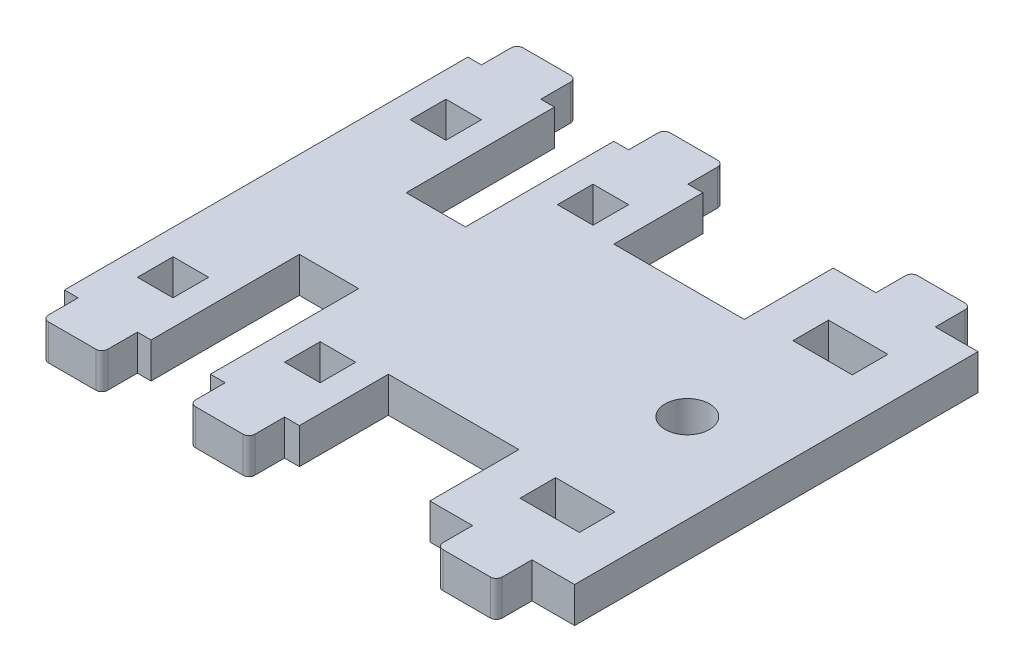
from build123d import *

# Parameters (mm, degrees)
SKETCH1_W                  = 86
SKETCH1_H                  = 68
BOSS_EXTRUDE1_DEPTH        = 6
SKETCH2_W                  = 10
SKETCH2_H                  = 25
SKETCH2_W_2                = 22
SKETCH2_H_2                = 15
CUT_EXTRUDE1_DEPTH         = 110.79981785
F_7_5_7_5_DIAMETER_HOLE1_D = 7.5
SKETCH234_W                = 10
SKETCH234_H                = 6
BOSS_EXTRUDE234_DEPTH      = 6
FILLET134_R                = 1
SKETCH2341_W               = 10
SKETCH2341_H               = 6
BOSS_EXTRUDE2341_DEPTH     = 6
FILLET1341_R               = 1
SKETCH2342_W               = 10
SKETCH2342_H               = 6
BOSS_EXTRUDE2342_DEPTH     = 6
FILLET1342_R               = 1
CUT_EXTRUDE11_START        = -3
SKETCH6_W                  = 10
SKETCH6_H                  = 6
CUT_EXTRUDE11_DEPTH        = 6
CUT_EXTRUDE16_DEPTH        = 82.966859266
CUT_EXTRUDE16_DEPTH_BACK   = 82.966859266
SKETCH64_W                 = 6
SKETCH64_H                 = 6
CUT_EXTRUDE18_DEPTH        = 101.225385192
CUT_EXTRUDE18_DEPTH_BACK   = 101.225385192
SKETCH66_W                 = 6
SKETCH66_H                 = 6
MIRROR2_OUTLINE_W          = 10
MIRROR2_OUTLINE_H          = 6
MIRROR2_OUTLINE_W_2        = 6
MIRROR2_DEPTH              = 6
MIRROR2_2_DEPTH            = 6


# Read off the part's stored shape, not the designer's step: Mirror2
with BuildPart() as part:
    # Sketch1 → Boss-Extrude1 (new body)
    with BuildSketch(Plane(origin=(0, 0, 0), x_dir=(1, 0, 0), z_dir=(0, 1, 0))):
        with Locations((43, -34)):
            Rectangle(SKETCH1_W, SKETCH1_H)
    extrude(amount=BOSS_EXTRUDE1_DEPTH)

    # Sketch2 → Cut-Extrude1 (cut, through all)
    with BuildSketch(Plane(origin=(0, 6, 0), x_dir=(1, 0, 0), z_dir=(0, 1, 0))):
        with Locations((19.6, -55.5)):
            Rectangle(SKETCH2_W, SKETCH2_H)
        with Locations((50.6, -60.5)):
            Rectangle(SKETCH2_W_2, SKETCH2_H_2)
    cut_extrude1 = extrude(amount=-CUT_EXTRUDE1_DEPTH, mode=Mode.SUBTRACT)

    # Mirror1: Cut-Extrude1 across plane
    add(cut_extrude1.mirror(Plane.XY.offset(34)), mode=Mode.SUBTRACT)

    # Ø7.5 (7.5) Diameter Hole1 (through all)
    with Locations(Plane(origin=(0, 0, 0), x_dir=(-1, 0, 0), z_dir=(0, -1, 0))):
        with Locations((-71, -34)):
            Hole(F_7_5_7_5_DIAMETER_HOLE1_D / 2)

    # Sketch234 → Boss-Extrude234 (add)
    with BuildSketch(Plane(origin=(73.032221392, 0, 68), x_dir=(1, 0, 0), z_dir=(0, 0, 1))):
        with Locations((0.767778608, 3)):
            Rectangle(SKETCH234_W, SKETCH234_H)
    extrude(amount=BOSS_EXTRUDE234_DEPTH)

    # Fillet134
    fillet134_edges = [part.edges().sort_by_distance(p)[0] for p in [
        (78.8, 3, 74),
        (68.8, 3, 74),
    ]]
    fillet(fillet134_edges, radius=FILLET134_R)

    # Sketch2341 → Boss-Extrude2341 (add)
    with BuildSketch(Plane(origin=(31.332221392, 0, 68), x_dir=(1, 0, 0), z_dir=(0, 0, 1))):
        with Locations((0.767778608, 3)):
            Rectangle(SKETCH2341_W, SKETCH2341_H)
    extrude(amount=BOSS_EXTRUDE2341_DEPTH)

    # Fillet1341
    fillet1341_edges = [part.edges().sort_by_distance(p)[0] for p in [
        (37.1, 3, 74),
        (27.1, 3, 74),
    ]]
    fillet(fillet1341_edges, radius=FILLET1341_R)

    # Sketch2342 → Boss-Extrude2342 (add)
    with BuildSketch(Plane(origin=(6.532221392, 0, 68), x_dir=(1, 0, 0), z_dir=(0, 0, 1))):
        with Locations((0.767778608, 3)):
            Rectangle(SKETCH2342_W, SKETCH2342_H)
    extrude(amount=BOSS_EXTRUDE2342_DEPTH)

    # Fillet1342
    fillet1342_edges = [part.edges().sort_by_distance(p)[0] for p in [
        (12.3, 3, 74),
        (2.3, 3, 74),
    ]]
    fillet(fillet1342_edges, radius=FILLET1342_R)

    # Sketch6 → Cut-Extrude11 (cut)
    with BuildSketch(Plane(origin=(73.032221392, 3, 13), x_dir=(1, 0, 0), z_dir=(0, 1, 0)).offset(CUT_EXTRUDE11_START)):
        with Locations((0.767778608, -44)):
            Rectangle(SKETCH6_W, SKETCH6_H)
    extrude(amount=CUT_EXTRUDE11_DEPTH, mode=Mode.SUBTRACT)

    # Sketch64 → Cut-Extrude16 (cut, two sides: drawn at the far end of the back side and taken through both)
    with BuildSketch(Plane(origin=(31.332221392, 3, 13), x_dir=(1, 0, 0), z_dir=(0, 1, 0)).offset(-CUT_EXTRUDE16_DEPTH_BACK)):
        with Locations((0.767778608, -44)):
            Rectangle(SKETCH64_W, SKETCH64_H)
    extrude(amount=CUT_EXTRUDE16_DEPTH + CUT_EXTRUDE16_DEPTH_BACK, mode=Mode.SUBTRACT)

    # Sketch66 → Cut-Extrude18 (cut, two sides: drawn at the far end of the back side and taken through both)
    with BuildSketch(Plane(origin=(6.532221392, 3, 13), x_dir=(1, 0, 0), z_dir=(0, 1, 0)).offset(-CUT_EXTRUDE18_DEPTH_BACK)):
        with Locations((0.767778608, -44)):
            Rectangle(SKETCH66_W, SKETCH66_H)
    extrude(amount=CUT_EXTRUDE18_DEPTH + CUT_EXTRUDE18_DEPTH_BACK, mode=Mode.SUBTRACT)

    # Mirror2 outline → Mirror2 (cut)
    with BuildSketch(Plane(origin=(0, 0, 0), x_dir=(1, 0, 0), z_dir=(0, 1, 0))):
        with Locations((73.8, -11)):
            Rectangle(MIRROR2_OUTLINE_W, MIRROR2_OUTLINE_H)
        with Locations((32.1, -11)):
            Rectangle(MIRROR2_OUTLINE_W_2, MIRROR2_OUTLINE_H)
        with Locations((7.3, -11)):
            Rectangle(MIRROR2_OUTLINE_W_2, MIRROR2_OUTLINE_H)
    extrude(amount=MIRROR2_DEPTH, mode=Mode.SUBTRACT)

    # Mirror2 2 outline → Mirror2 2 (add)
    with BuildSketch(Plane(origin=(0, 0, 0), x_dir=(1, 0, 0), z_dir=(0, 1, 0))):
        with BuildLine():
            Line((68.8, 0), (78.8, 0))
            Line((78.8, 0), (78.8, 5))
            ThreePointArc((78.8, 5), (78.507106781, 5.707106781), (77.8, 6))
            Line((77.8, 6), (69.8, 6))
            ThreePointArc((69.8, 6), (69.092893219, 5.707106781), (68.8, 5))
            Line((68.8, 5), (68.8, 0))
        make_face()
        with BuildLine():
            Line((27.1, 0), (37.1, 0))
            Line((37.1, 0), (37.1, 5))
            ThreePointArc((37.1, 5), (36.807106781, 5.707106781), (36.1, 6))
            Line((36.1, 6), (28.1, 6))
            ThreePointArc((28.1, 6), (27.392893219, 5.707106781), (27.1, 5))
            Line((27.1, 5), (27.1, 0))
        make_face()
        with BuildLine():
            Line((2.3, 0), (12.3, 0))
            Line((12.3, 0), (12.3, 5))
            ThreePointArc((12.3, 5), (12.007106781, 5.707106781), (11.3, 6))
            Line((11.3, 6), (3.3, 6))
            ThreePointArc((3.3, 6), (2.592893219, 5.707106781), (2.3, 5))
            Line((2.3, 5), (2.3, 0))
        make_face()
    extrude(amount=MIRROR2_2_DEPTH)


solid = part.part
